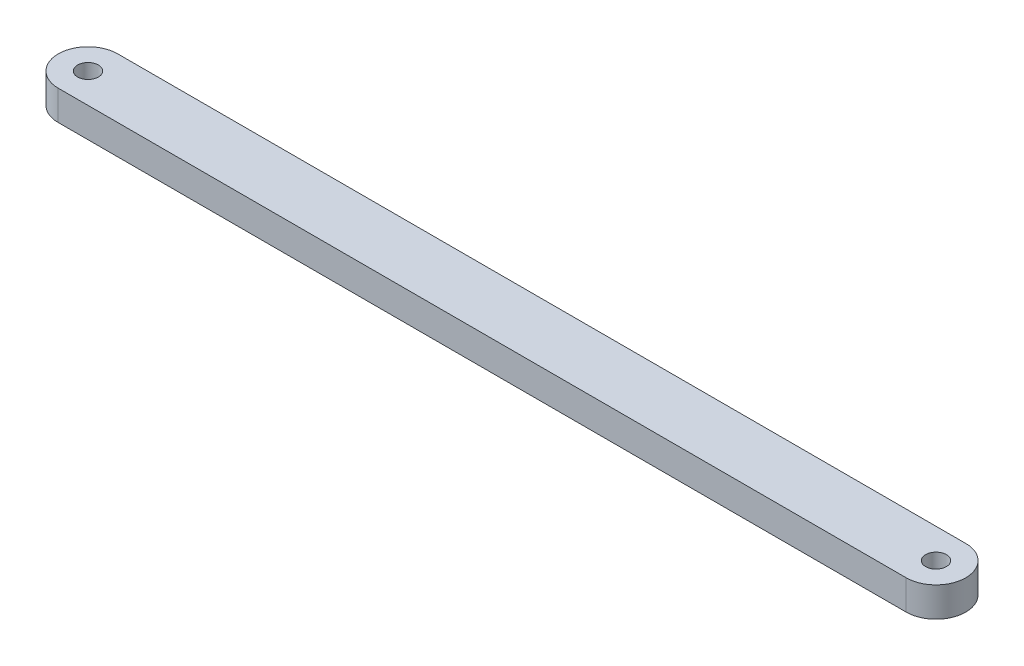
from build123d import *

# Parameters (mm, degrees)
SKETCH1_R           = 3.5
BOSS_EXTRUDE1_DEPTH = 10


with BuildPart() as part:
    # Sketch1 → Boss-Extrude1 (new body)
    with BuildSketch(Plane(origin=(0, 0, 0), x_dir=(1, 0, 0), z_dir=(0, 1, 0))):
        with BuildLine():
            Line((-142.5, 10), (142.5, 10))
            ThreePointArc((142.5, 10), (152.5, 0), (142.5, -10))
            Line((142.5, -10), (-142.5, -10))
            ThreePointArc((-142.5, -10), (-152.5, 0), (-142.5, 10))
        make_face()
        with Locations((-142.5, 0)):
            Circle(SKETCH1_R, mode=Mode.SUBTRACT)
        with Locations((142.5, 0)):
            Circle(SKETCH1_R, mode=Mode.SUBTRACT)
    extrude(amount=BOSS_EXTRUDE1_DEPTH)


solid = part.part
